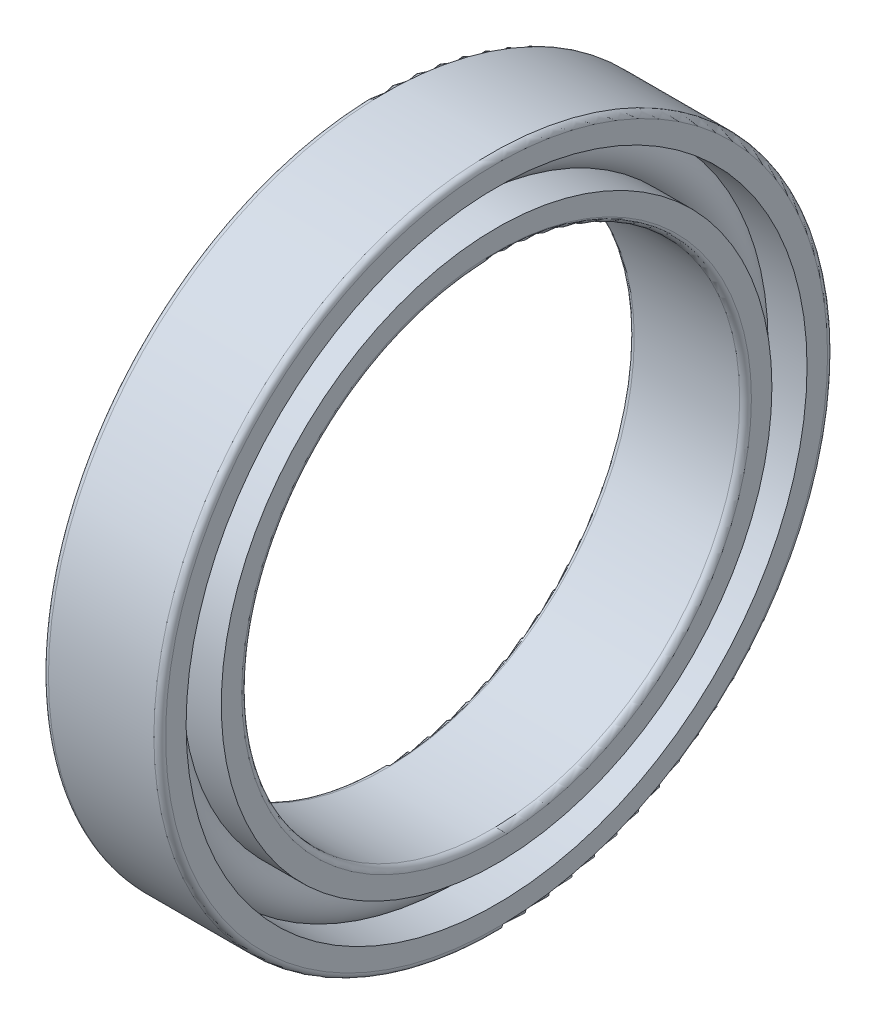
from build123d import *

# Parameters (mm, degrees)
CAGSPISKE_W     = 0.18
CAGSPISKE_H     = 0.3
CAGESPINE_ANGLE = 0.001
BALSIMSKE_R     = 0.9


with BuildPart() as part:
    # CagSpiSke → CageSpine (revolve)
    with BuildSketch(Plane.XY):
        with Locations((0, 10)):
            Rectangle(CAGSPISKE_W, CAGSPISKE_H)
    revolve(axis=Axis((-20.6375, 0, 0), (-1, 0, 0)), revolution_arc=CAGESPINE_ANGLE)

    # BalSimSke → BallsSimplified (revolve)
    with BuildSketch(Plane.XY):
        with Locations((0, 10)):
            Circle(BALSIMSKE_R)
    revolve(axis=Axis((-10, 0, 0), (1, 0, 0)))

    # InnRacSke → InnerRace (revolve)
    with BuildSketch(Plane.XY):
        with BuildLine():
            Line((-0.63688696, 9.4), (-2, 9.4))
            Line((-2, 9.4), (-2, 8.7))
            ThreePointArc((-2, 8.7), (-1.941421356, 8.558578644), (-1.8, 8.5))
            Line((-1.8, 8.5), (1.8, 8.5))
            ThreePointArc((1.8, 8.5), (1.941421356, 8.558578644), (2, 8.7))
            Line((2, 8.7), (2, 9.4))
            Line((2, 9.4), (0.63688696, 9.4))
            ThreePointArc((0.63688696, 9.4), (0, 9.125), (-0.63688696, 9.4))
        make_face()
    revolve(axis=Axis((-20.6375, 0, 0), (1, 0, 0)))

    # OutRacSke → OuterRace (revolve)
    with BuildSketch(Plane.XY):
        with BuildLine():
            Line((-0.63688696, 10.6), (-2, 10.6))
            Line((-2, 10.6), (-2, 11.3))
            ThreePointArc((-2, 11.3), (-1.941421356, 11.441421356), (-1.8, 11.5))
            Line((-1.8, 11.5), (1.8, 11.5))
            ThreePointArc((1.8, 11.5), (1.941421356, 11.441421356), (2, 11.3))
            Line((2, 11.3), (2, 10.6))
            Line((2, 10.6), (0.63688696, 10.6))
            ThreePointArc((0.63688696, 10.6), (0, 10.875), (-0.63688696, 10.6))
        make_face()
    revolve(axis=Axis((-20.6375, 0, 0), (1, 0, 0)))


solid = part.part
